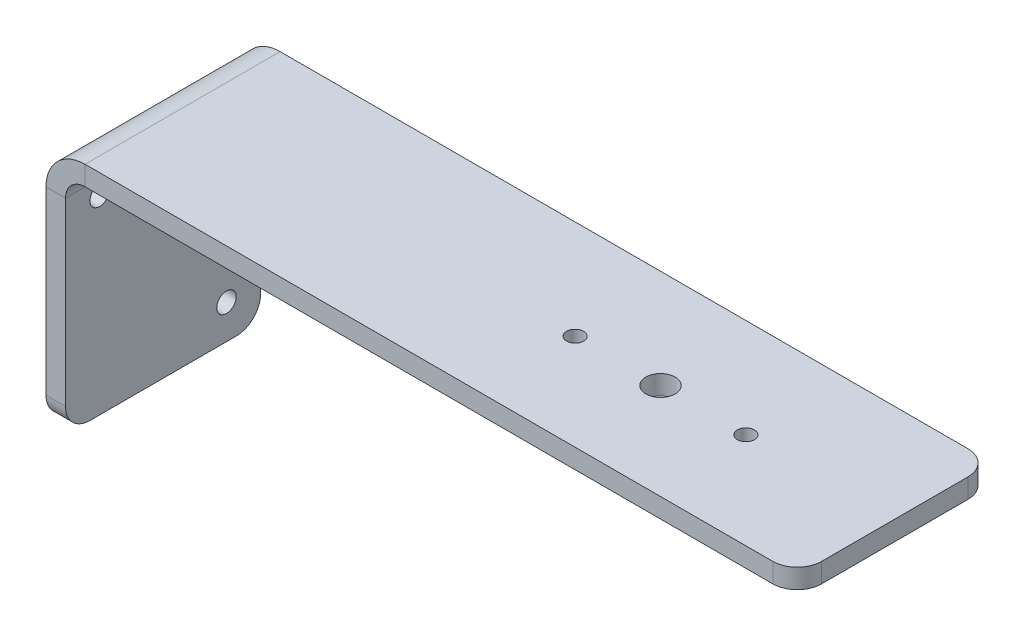
from build123d import *

# Parameters (mm, degrees)
SKETCH1_W                    = 150
SKETCH1_H                    = 40
BASE_FLANGE1_DEPTH           = 4
EDGE_FLANGE1_STRIP_W         = 24
EDGE_FLANGE1_STRIP_H         = 4
EDGE_FLANGE1_STRIP_CUT_DEPTH = 40
EDGE_FLANGE1_DEPTH           = 40
SKETCH9_R                    = 2
CUT_EXTRUDE1_DEPTH           = 10
FILLET1_R                    = 5
SKETCH10_R                   = 3.009837712
SKETCH10_R_2                 = 1.75
CUT_EXTRUDE2_DEPTH           = 10


# Sheet-metal steps are written as plain solids
with BuildPart() as part:
    # Sketch1 → Base-Flange1 (new body)
    with BuildSketch(Plane(origin=(0, 0, 0), x_dir=(1, 0, 0), z_dir=(0, 1, 0))):
        with Locations((75, 20)):
            Rectangle(SKETCH1_W, SKETCH1_H)
    extrude(amount=-BASE_FLANGE1_DEPTH)

    # Edge-Flange1 strip (across the edge) → Edge-Flange1 strip cut (cut)
    with BuildSketch(Plane(origin=(0, -4, 0), x_dir=(1, 0, 0), z_dir=(0, 0, -1))):
        with Locations((-8, -2)):
            Rectangle(EDGE_FLANGE1_STRIP_W, EDGE_FLANGE1_STRIP_H)
    extrude(amount=EDGE_FLANGE1_STRIP_CUT_DEPTH, mode=Mode.SUBTRACT)

    # Edge-Flange1 section (across the edge) → Edge-Flange1 (add)
    with BuildSketch(Plane(origin=(0, -4, 0), x_dir=(1, 0, 0), z_dir=(0, 0, -1))):
        with BuildLine():
            Line((-4, 4), (-4, 46))
            Line((-4, 46), (0, 46))
            Line((0, 46), (0, 4))
            ThreePointArc((0, 4), (1.171572875, 1.171572875), (4, 0))
            Line((4, 0), (4, -4))
            ThreePointArc((4, -4), (-1.656854249, -1.656854249), (-4, 4))
        make_face()
    extrude(amount=EDGE_FLANGE1_DEPTH)

    # Sketch9 → Cut-Extrude1 (cut)
    with BuildSketch(Plane(origin=(0, 0, 0), x_dir=(0, 0, -1), z_dir=(1, 0, 0))):
        with Locations(Location((7, -11, 0), (0, 0, 90))):
            Circle(SKETCH9_R)
        with Locations(Location((33, -43, 0), (0, 0, 90))):
            Circle(SKETCH9_R)
    extrude(amount=-CUT_EXTRUDE1_DEPTH, mode=Mode.SUBTRACT)

    # Fillet1
    fillet1_edges = [part.edges().sort_by_distance(p)[0] for p in [
        (-2, -50, 0),
        (-2, -50, -40),
        (150, -2, -40),
        (150, -2, 0),
    ]]
    fillet(fillet1_edges, radius=FILLET1_R)

    # Sketch10 → Cut-Extrude2 (cut)
    with BuildSketch(Plane(origin=(0, 0, 0), x_dir=(1, 0, 0), z_dir=(0, 1, 0))):
        with Locations(Location((102.263543229, 19.709585113, 0), (0, 0, 270))):
            Circle(SKETCH10_R)
        with Locations(Location((119.763543229, 19.709585113, 0), (0, 0, 270))):
            Circle(SKETCH10_R_2)
        with Locations(Location((84.763543229, 19.709585113, 0), (0, 0, 270))):
            Circle(SKETCH10_R_2)
    extrude(amount=-CUT_EXTRUDE2_DEPTH, mode=Mode.SUBTRACT)


solid = part.part
